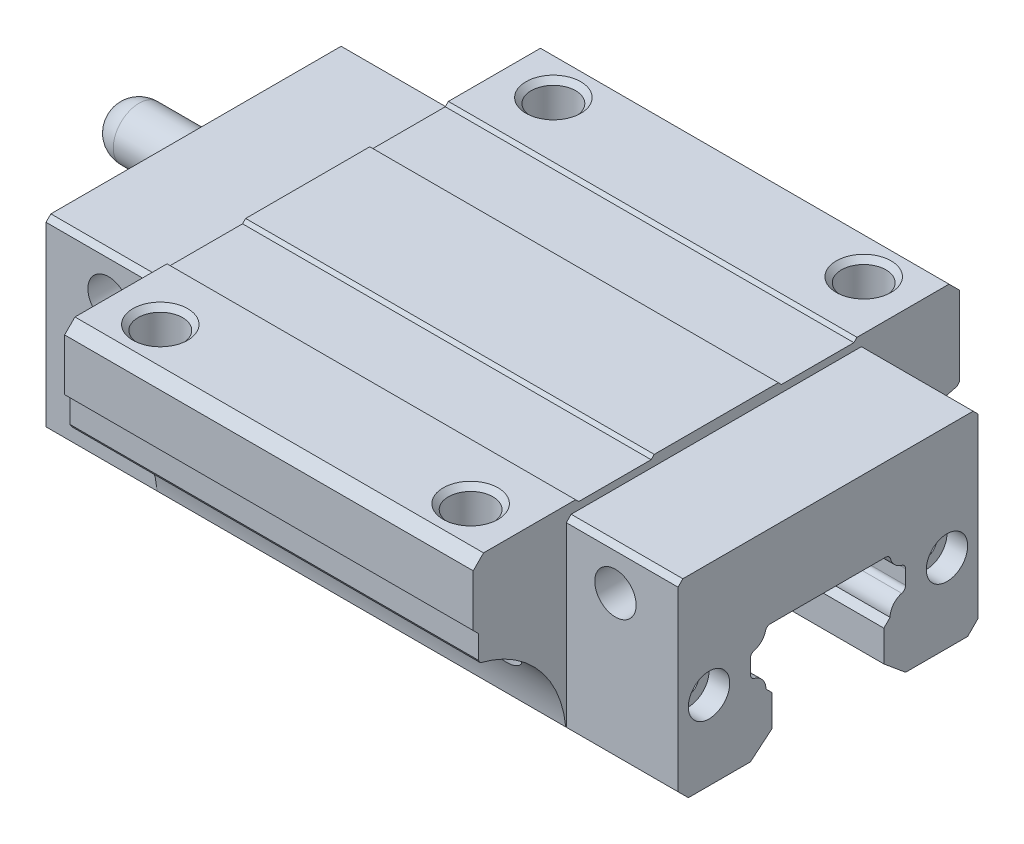
from build123d import *

# Parameters (mm, degrees)
EXTRUDE_1_DEPTH          = 30.55
EXTRUDE_2_DEPTH          = 19.75
SKETCH_14_R              = 2.15
CUT_EXTRUDE_7_DEPTH      = 44.240172294
CUT_EXTRUDE_2_DEPTH      = 42.926155416
CUT_EXTRUDE_2_DEPTH_BACK = 42.926155416
SKETCH_13_R              = 2
CUT_EXTRUDE_6_DEPTH      = 2
SKETCH_16_R              = 1
CUT_EXTRUDE_11_DEPTH     = 5
SKETCH_12_R              = 2
CUT_EXTRUDE_5_DEPTH      = 5
SKETCH_15_R              = 3.5
CUT_EXTRUDE_10_DEPTH     = 10.7
CUT_EXTRUDE_8_DEPTH      = 58.918822542
CHAMFER_1_SIZE           = 0.47
CHAMFER_2_SIZE           = 0.26359415
CHAMFER_2_SIZE_2         = 0.24572937
CHAMFER_START            = -13
CHAMFER_3_OUTLINE_W      = 64
CHAMFER_3_OUTLINE_H      = 21.737972568
CHAMFER_3_DEPTH          = 1.262027432
CHAMFER_START_2          = 3.111269837
CHAMFER_3_2_DEPTH        = 24.465894629
CHAMFER_4_SIZE           = 0.5
FILLET_1_R               = 0.5


with BuildPart() as part:
    # 草图1 → 凸台-拉伸1 (new, symmetric)
    with BuildSketch(Plane(origin=(0, 0, 0), x_dir=(0, 0, -1), z_dir=(1, 0, 0))):
        with BuildLine():
            Line((-14.5, 15.5), (14.5, 15.5))
            Line((14.5, 15.5), (14.5, -3.1))
            Line((14.5, -3.1), (7.5, -3.1))
            Line((7.5, -3.1), (5.4, -1.35))
            Line((5.4, -1.35), (5.4, 1.65))
            Line((5.4, 1.65), (6, 2.25))
            ThreePointArc((6, 2.25), (6.439339828, 3.310660172), (7.5, 3.75))
            Line((7.5, 3.75), (7.5, 6))
            ThreePointArc((7.5, 6), (6.439339828, 6.439339828), (6, 7.5))
            Line((6, 7.5), (-6, 7.5))
            ThreePointArc((-6, 7.5), (-6.439339828, 6.439339828), (-7.5, 6))
            Line((-7.5, 6), (-7.5, 3.75))
            ThreePointArc((-7.5, 3.75), (-6.439339828, 3.310660172), (-6, 2.25))
            Line((-6, 2.25), (-5.4, 1.65))
            Line((-5.4, 1.65), (-5.4, -1.35))
            Line((-5.4, -1.35), (-7.5, -3.1))
            Line((-7.5, -3.1), (-14.5, -3.1))
            Line((-14.5, -3.1), (-14.5, 15.5))
        make_face()
    extrude(amount=EXTRUDE_1_DEPTH, both=True)

    # 草图2 → 凸台-拉伸2 (add, symmetric)
    with BuildSketch(Plane(origin=(0, 0, 0), x_dir=(0, 0, -1), z_dir=(1, 0, 0))):
        with BuildLine():
            Line((23.5, 7.6), (23.5, 15.5))
            Line((23.5, 15.5), (22.5, 16.5))
            Line((22.5, 16.5), (-22.5, 16.5))
            Line((-22.5, 16.5), (-23.5, 15.5))
            Line((-23.5, 15.5), (-23.5, 7.6))
            ThreePointArc((-23.5, 7.6), (-17.049167767, 3.890886925), (-14.5, -3.1))
            Line((-14.5, -3.1), (-14.5, 15.5))
            Line((-14.5, 15.5), (14.5, 15.5))
            Line((14.5, 15.5), (14.5, -3.1))
            ThreePointArc((14.5, -3.1), (17.049167767, 3.890886925), (23.5, 7.6))
        make_face()
    extrude(amount=EXTRUDE_2_DEPTH, both=True)

    # 草图14 → 切除-拉伸7 (cut, through all)
    with BuildSketch(Plane(origin=(0, 16.5, 0), x_dir=(1, 0, 0), z_dir=(0, 1, 0))):
        with Locations(Location((15, 19, 0), (0, 0, 270))):
            Circle(SKETCH_14_R)
        with Locations(Location((15, -19, 0), (0, 0, 270))):
            Circle(SKETCH_14_R)
        with Locations(Location((-15, -19, 0), (0, 0, 270))):
            Circle(SKETCH_14_R)
        with Locations(Location((-15, 19, 0), (0, 0, 270))):
            Circle(SKETCH_14_R)
    extrude(amount=-CUT_EXTRUDE_7_DEPTH, mode=Mode.SUBTRACT)

    # 草图5 → 切除-拉伸2 (cut, two sides: drawn at the far end of the back side and taken through both)
    with BuildSketch(Plane(origin=(0, 0, 0), x_dir=(0, 0, -1), z_dir=(1, 0, 0)).offset(-CUT_EXTRUDE_2_DEPTH_BACK)):
        Polygon((-23, 10), (-23, 7.1), (-23.5, 7.6), (-23.5, 10.5), align=None)
    extrude(amount=CUT_EXTRUDE_2_DEPTH + CUT_EXTRUDE_2_DEPTH_BACK, mode=Mode.SUBTRACT)

    # 草图18 → 旋转1 (revolve)
    with BuildSketch(Plane.XY):
        with BuildLine():
            Line((-30.55, 12.5), (-38.55, 12.5))
            ThreePointArc((-38.55, 12.5), (-37.817766953, 14.267766953), (-36.05, 15))
            Line((-36.05, 15), (-30.55, 15))
            Line((-30.55, 15), (-30.55, 12.5))
        make_face()
    revolve(axis=Axis((-30.55, 12.5, 0), (-1, 0, 0)))

    # 草图13 → 切除-拉伸6 (cut)
    with BuildSketch(Plane.ZY.offset(30.55)):
        with Locations((-11.5, 4.5)):
            Circle(SKETCH_13_R)
        with Locations(Location((11.5, 4.5, 0), (0, 0, 180))):
            Circle(SKETCH_13_R)
    cut_extrude_6 = extrude(amount=-CUT_EXTRUDE_6_DEPTH, mode=Mode.SUBTRACT)

    # 草图16 → 切除-拉伸11 (cut)
    with BuildSketch(Plane.ZY.offset(28.55)):
        with Locations((-11.5, 4.5)):
            Circle(SKETCH_16_R)
        with Locations((11.5, 4.5)):
            Circle(SKETCH_16_R)
    cut_extrude_11 = extrude(amount=-CUT_EXTRUDE_11_DEPTH, mode=Mode.SUBTRACT)

    # 镜向3: 切除-拉伸6, 切除-拉伸11 across plane
    add(cut_extrude_6.mirror(Plane(origin=(0, 0, 0), x_dir=(0, 0, 1), z_dir=(1, 0, 0))), mode=Mode.SUBTRACT)
    add(cut_extrude_11.mirror(Plane(origin=(0, 0, 0), x_dir=(0, 0, 1), z_dir=(1, 0, 0))), mode=Mode.SUBTRACT)

    # 草图12 → 切除-拉伸5 (cut)
    with BuildSketch(Plane.XY.offset(14.5)):
        with Locations((-24.5, 11.5)):
            Circle(SKETCH_12_R)
        with Locations(Location((24.5, 11.5, 0), (0, 0, 180))):
            Circle(SKETCH_12_R)
    cut_extrude_5 = extrude(amount=-CUT_EXTRUDE_5_DEPTH, mode=Mode.SUBTRACT)

    # 草图15 → 切除-拉伸10 (cut)
    with BuildSketch(Plane.XZ.offset(3.1)):
        with Locations(Location((15, 19, 0), (0, 0, 270))):
            Circle(SKETCH_15_R)
        with Locations(Location((15, -19, 0), (0, 0, 270))):
            Circle(SKETCH_15_R)
        with Locations(Location((-15, 19, 0), (0, 0, 270))):
            Circle(SKETCH_15_R)
        with Locations(Location((-15, -19, 0), (0, 0, 270))):
            Circle(SKETCH_15_R)
    extrude(amount=-CUT_EXTRUDE_10_DEPTH, mode=Mode.SUBTRACT)

    # 镜向4: 切除-拉伸5 across plane
    add(cut_extrude_5.mirror(Plane.XY), mode=Mode.SUBTRACT)

    # 草图3 → 切除-拉伸8 (cut, through all)
    with BuildSketch(Plane.ZY.offset(19.75)):
        Polygon((-6, 16.5), (-6.3, 16.2), (-13.3, 16.2), (-13.6, 16.5), align=None)
        Polygon((13.6, 16.5), (13.3, 16.2), (6.3, 16.2), (6, 16.5), align=None)
    extrude(amount=-CUT_EXTRUDE_8_DEPTH, mode=Mode.SUBTRACT)

    # 倒角1
    chamfer_1_edges = [part.edges().sort_by_distance(p)[0] for p in [
        (25.15, -3.1, 14.5),
        (25.15, 15.5, 14.5),
        (25.15, 15.5, -14.5),
        (25.15, -3.1, -14.5),
        (-25.15, -3.1, 14.5),
        (-25.15, 15.5, 14.5),
        (-25.15, 15.5, -14.5),
        (-25.15, -3.1, -14.5),
    ]]
    chamfer(chamfer_1_edges, length=CHAMFER_1_SIZE)

    # 倒角2
    # the kernel refuses this chamfer: 0.26359415, 0.24572937, 0.2 mm, written as the material it takes off along each edge
    with BuildSketch(Plane(origin=(-20.431376675, 7.500917151, 23), x_dir=(0, -0.22641410518634636, -0.97403113552528), z_dir=(1, 0, 0))) as chamfer_2_piece_1:
        with BuildLine():
            Line((0.201885125, 0), (-CHAMFER_2_SIZE * 0.226414105253, CHAMFER_2_SIZE * 0.974031135813))
            Line((-CHAMFER_2_SIZE * 0.226414105253, CHAMFER_2_SIZE * 0.974031135813), (0, 0))
            ThreePointArc((0, 0), (0.104706276, 0.000468459), (0.201885125, 0))
        make_face()
    extrude(amount=40.862753349, mode=Mode.SUBTRACT)
    with BuildSketch(Plane(origin=(-20.384576532, 7.6, -23.5), x_dir=(0, -0.18046272794534762, 0.9835818236539975), z_dir=(1, 0, 0))) as chamfer_2_piece_2:
        with BuildLine():
            Line((0.201885125, 0), (-CHAMFER_2_SIZE_2 * 0.180462727665, -CHAMFER_2_SIZE_2 * 0.983581822127))
            Line((-CHAMFER_2_SIZE_2 * 0.180462727665, -CHAMFER_2_SIZE_2 * 0.983581822127), (0, 0))
            ThreePointArc((0, 0), (0.104451114, -0.000468545), (0.201885125, 0))
        make_face()
    extrude(amount=40.769153064, mode=Mode.SUBTRACT)

    # 倒角3: read off the stored shape, not the designer's step
    # 倒角3 outline → 倒角3 (cut)
    with BuildSketch(Plane(origin=(0, 0, 0), x_dir=(1, 0, 0), z_dir=(0, 0.707106781186547, 0.707106781186548)).offset(CHAMFER_START)):
        with Locations((0, -0.868986284)):
            Rectangle(CHAMFER_3_OUTLINE_W, CHAMFER_3_OUTLINE_H)
    extrude(amount=CHAMFER_3_DEPTH, mode=Mode.SUBTRACT)

    # Chamfer 3 2 outline → Chamfer 3 2 (cut)
    with BuildSketch(Plane(origin=(0, 0, 0), x_dir=(1, 0, 0), z_dir=(0, 0.707106781186547, 0.707106781186548)).offset(CHAMFER_START_2)):
        Polygon((32, -11.737972568), (-32, -11.737972568), (-32, -12.112739162), (-19.75, -12.112739162), (-19.75, -14), (19.75, -14), (19.75, -12.112739162), (32, -12.112739162), align=None)
    extrude(amount=CHAMFER_3_2_DEPTH, mode=Mode.SUBTRACT)

    # 倒角4
    chamfer_4_edges = [part.edges().sort_by_distance(p)[0] for p in [
        (15, 16.5, -21.15),
        (15, 16.5, 16.85),
        (-15, 16.5, 16.85),
        (-15, 16.5, -21.15),
    ]]
    chamfer(chamfer_4_edges, length=CHAMFER_4_SIZE)

    # 圆角1
    fillet_1_edges = [part.edges().sort_by_distance(p)[0] for p in [
        (0, 3.75, -7.5),
        (0, 6, -7.5),
        (0, 7.5, -6),
        (0, 7.5, 6),
        (0, 6, 7.5),
        (0, 3.75, 7.5),
    ]]
    fillet(fillet_1_edges, radius=FILLET_1_R)


solid = part.part
